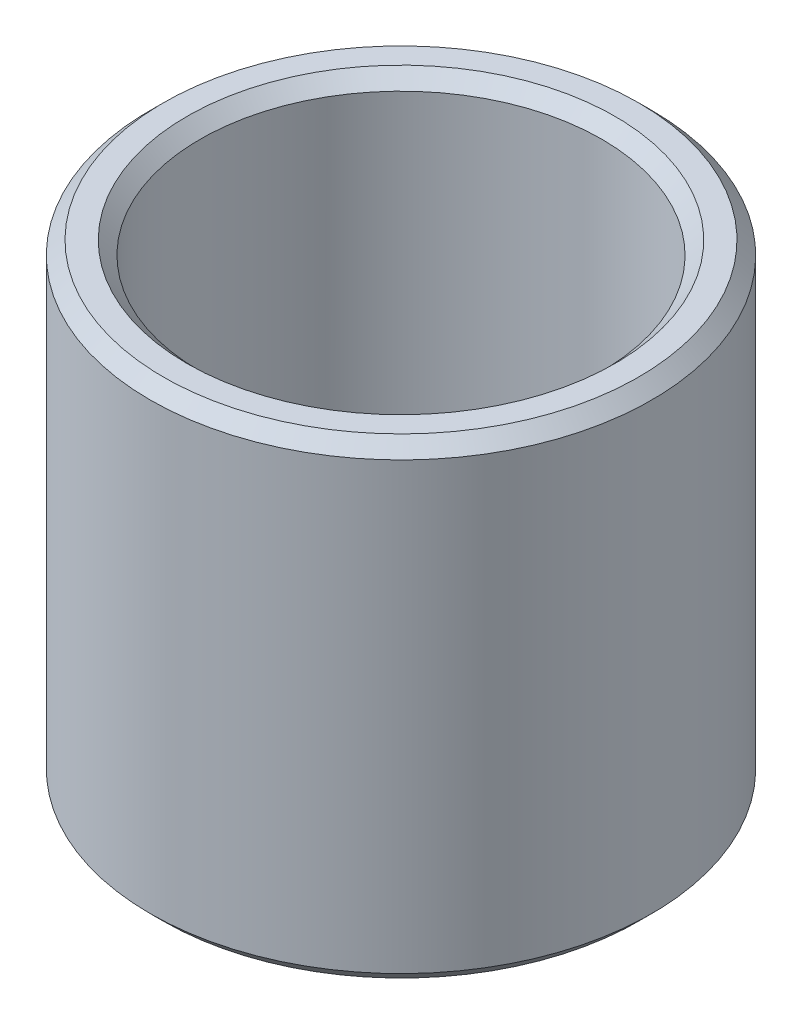
from build123d import *

# Parameters (mm, degrees)
SKETCH1_R           = 60
BOSS_EXTRUDE1_DEPTH = 112.732452654
SKETCH2_R           = 48.054333289
CUT_EXTRUDE1_DEPTH  = 142.097859237
CHAMFER1_SIZE       = 3.159443569


with BuildPart() as part:
    # Sketch1 → Boss-Extrude1 (new body)
    with BuildSketch(Plane(origin=(0, 0, 0), x_dir=(1, 0, 0), z_dir=(0, 1, 0))):
        Circle(SKETCH1_R)
    extrude(amount=BOSS_EXTRUDE1_DEPTH)

    # Sketch2 → Cut-Extrude1 (cut, through all)
    with BuildSketch(Plane(origin=(0, 0, 0), x_dir=(1, 0, 0), z_dir=(0, 1, 0))):
        Circle(SKETCH2_R)
    extrude(amount=CUT_EXTRUDE1_DEPTH, mode=Mode.SUBTRACT)

    # Chamfer1
    chamfer1_edges = [part.edges().sort_by_distance(p)[0] for p in [
        (-48.054333289, 112.732452654, 0),
        (-48.054333289, 0, 0),
        (-60, 0, 0),
        (-60, 112.732452654, 0),
    ]]
    chamfer(chamfer1_edges, length=CHAMFER1_SIZE)


solid = part.part
